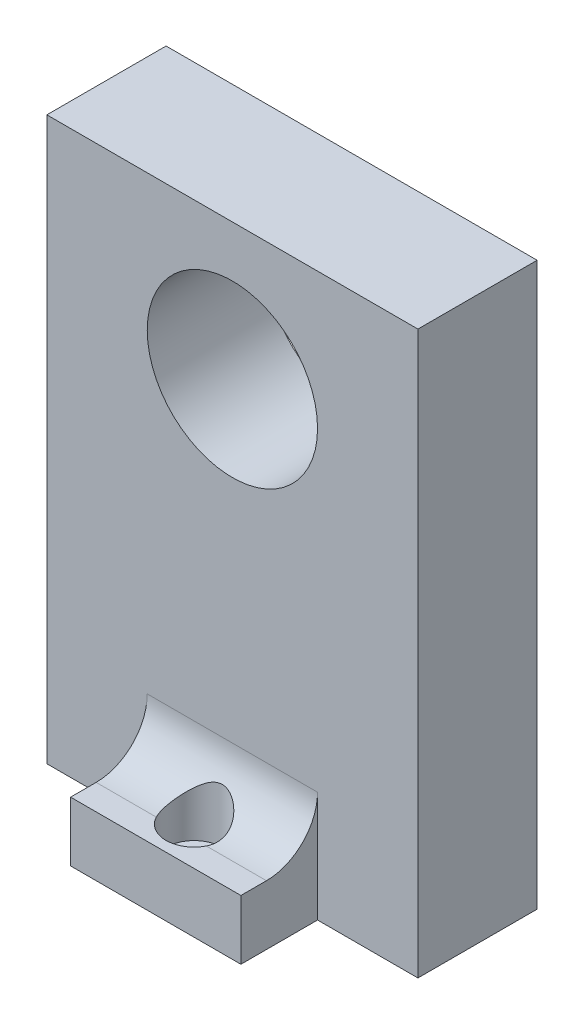
from build123d import *

# Parameters (mm, degrees)
SKETCH1_W           = 21.78773772
SKETCH1_H           = 33
BOSS_EXTRUDE1_DEPTH = 7
SKETCH2_R           = 5
CUT_EXTRUDE1_DEPTH  = 41.158504889
SKETCH3_W           = 10
SKETCH3_H           = 3.5
BOSS_EXTRUDE2_DEPTH = 4.5
SKETCH4_R           = 1
CUT_EXTRUDE2_DEPTH  = 39.434431373
SKETCH5_R           = 1.65
CUT_EXTRUDE3_DEPTH  = 2
FILLET1_R           = 3


with BuildPart() as part:
    # Sketch1 → Boss-Extrude1 (new body)
    with BuildSketch(Plane.XY):
        with Locations((10.89386886, 16.5)):
            Rectangle(SKETCH1_W, SKETCH1_H)
    extrude(amount=BOSS_EXTRUDE1_DEPTH)

    # Sketch2 → Cut-Extrude1 (cut, through all)
    with BuildSketch(Plane.XY.offset(7)):
        with Locations((10.89386886, 25)):
            Circle(SKETCH2_R)
    extrude(amount=-CUT_EXTRUDE1_DEPTH, mode=Mode.SUBTRACT)

    # Sketch3 → Boss-Extrude2 (add)
    with BuildSketch(Plane.XY.offset(7)):
        with Locations((10.89386886, 1.75)):
            Rectangle(SKETCH3_W, SKETCH3_H)
    boss_extrude2 = extrude(amount=BOSS_EXTRUDE2_DEPTH)

    # Mirror1: Boss-Extrude2 across plane
    add(boss_extrude2.mirror(Plane.XY.offset(3.5)))

    # Sketch4 → Cut-Extrude2 (cut, through all)
    with BuildSketch(Plane(origin=(0, 3.5, 0), x_dir=(1, 0, 0), z_dir=(0, 1, 0))):
        with Locations(Location((10.89386886, 2.25, 0), (0, 0, 180))):
            Circle(SKETCH4_R)
        with Locations(Location((10.89386886, -9.25, 0), (0, 0, 180))):
            Circle(SKETCH4_R)
    extrude(amount=-CUT_EXTRUDE2_DEPTH, mode=Mode.SUBTRACT)

    # Sketch5 → Cut-Extrude3 (cut)
    with BuildSketch(Plane(origin=(0, 3.5, 0), x_dir=(1, 0, 0), z_dir=(0, 1, 0))):
        with Locations(Location((10.89386886, 2.25, 0), (0, 0, 180))):
            Circle(SKETCH5_R)
        with Locations(Location((10.89386886, -9.25, 0), (0, 0, 180))):
            Circle(SKETCH5_R)
    extrude(amount=-CUT_EXTRUDE3_DEPTH, mode=Mode.SUBTRACT)

    # Fillet1
    # the kernel refuses this fillet: 3 mm, written as the material it adds along each edge
    with BuildSketch(Plane(origin=(15.89386886, 3.5, 7), x_dir=(0, 1, 0), z_dir=(-1, 0, 0))) as fillet1_piece_1_section:
        with BuildLine():
            CenterArc((FILLET1_R, -FILLET1_R), FILLET1_R, 90, 90)
            Line((0, -FILLET1_R), (0, 0))
            Line((0, 0), (FILLET1_R, 0))
        make_face()
    fillet1_piece_1 = extrude(amount=10, mode=Mode.PRIVATE)
    fillet1_piece_1 = fillet1_piece_1 - Plane(origin=(10.89386886, 4.228948509, 9.25), x_dir=(-1, 0, 0), z_dir=(0, 1, 0)) * Cylinder(1.65, 32, mode=Mode.PRIVATE)
    add(fillet1_piece_1)
    with BuildSketch(Plane(origin=(15.89386886, 3.5, 0), x_dir=(0, 1, 0), z_dir=(-1, 0, 0))) as fillet1_piece_2_section:
        with BuildLine():
            CenterArc((FILLET1_R, FILLET1_R), FILLET1_R, 180, 90)
            Line((0, FILLET1_R), (0, 0))
            Line((0, 0), (FILLET1_R, 0))
        make_face()
    fillet1_piece_2 = extrude(amount=10, mode=Mode.PRIVATE)
    fillet1_piece_2 = fillet1_piece_2 - Plane(origin=(10.89386886, 4.228948802, -2.25), x_dir=(-1, 0, 0), z_dir=(0, 1, 0)) * Cylinder(1.65, 32, mode=Mode.PRIVATE)
    add(fillet1_piece_2)


solid = part.part
